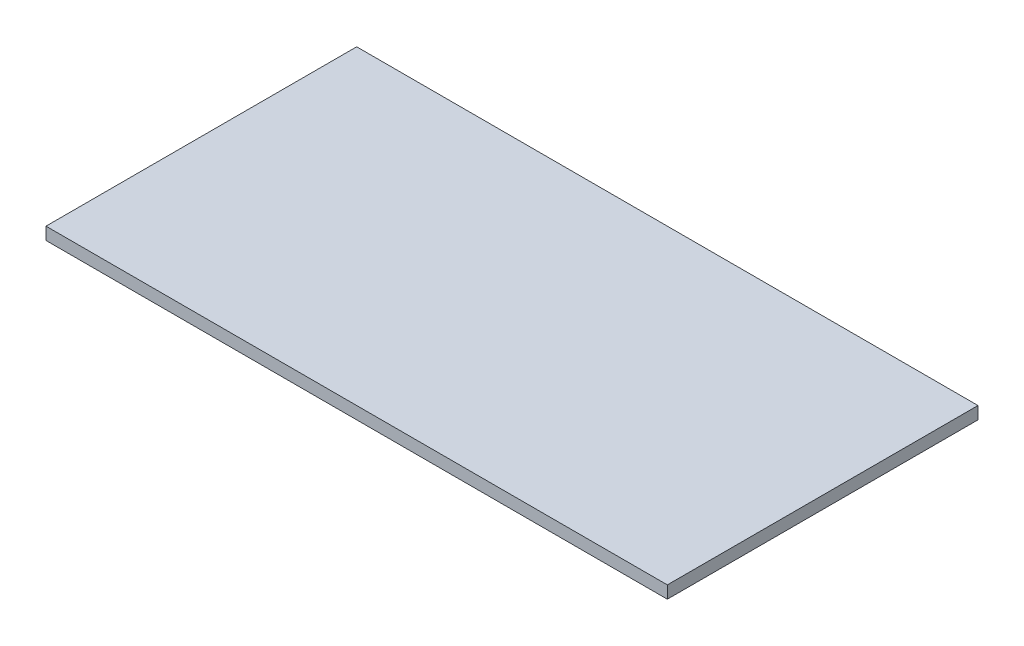
from build123d import *

# Parameters (mm, degrees)
SKETCH1_W           = 1000
SKETCH1_H           = 500
BOSS_EXTRUDE1_DEPTH = 20


with BuildPart() as part:
    # Sketch1 → Boss-Extrude1 (new body)
    with BuildSketch(Plane(origin=(0, 0, 0), x_dir=(1, 0, 0), z_dir=(0, 1, 0))):
        Rectangle(SKETCH1_W, SKETCH1_H)
    extrude(amount=BOSS_EXTRUDE1_DEPTH)


solid = part.part
